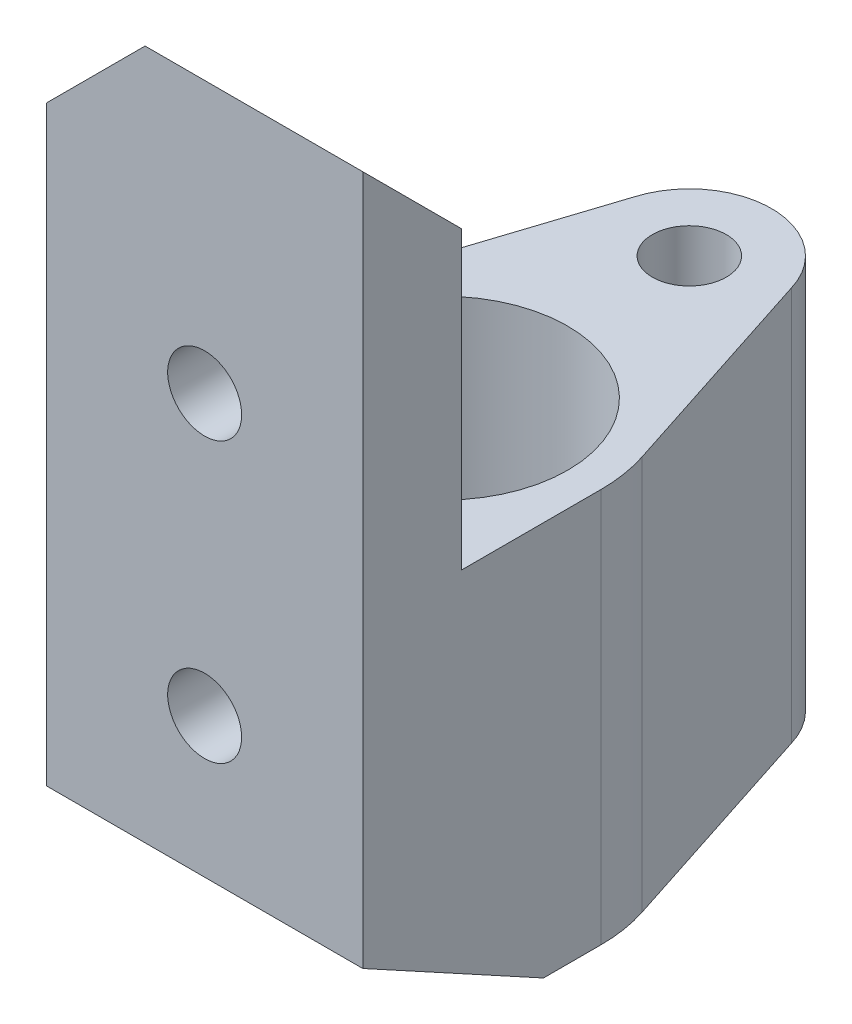
from build123d import *

# Parameters (mm, degrees)
SKETCH1_R           = 7.6
SKETCH1_R_2         = 2.25
BOSS_EXTRUDE1_DEPTH = 24
BOSS_EXTRUDE2_DEPTH = 19.25
CUT_EXTRUDE1_DEPTH  = 56.448737587
CHAMFER1_SIZE       = 6
SKETCH6_R           = 2.25
CUT_EXTRUDE3_DEPTH  = 16
CHAMFER2_SIZE       = 6


with BuildPart() as part:
    # Sketch1 → Boss-Extrude1 (new body)
    with BuildSketch(Plane(origin=(0, 0, 0), x_dir=(1, 0, 0), z_dir=(0, 1, 0))):
        with BuildLine():
            Line((-9.625, -8.5), (9.625, -8.5))
            Line((9.625, -8.5), (9.625, 0))
            ThreePointArc((9.625, 0), (9.506941676, 1.502892202), (9.155662863, 2.968916054))
            Line((9.155662863, 2.968916054), (4.796712187, 16.411223653))
            ThreePointArc((4.796712187, 16.411223653), (0, 20), (-4.796712187, 16.411223653))
            Line((-4.796712187, 16.411223653), (-9.155662863, 2.968916054))
            ThreePointArc((-9.155662863, 2.968916054), (-9.506941676, 1.502892202), (-9.625, 0))
            Line((-9.625, 0), (-9.625, -8.5))
        make_face()
        with Locations(Location((0, 0, 0), (0, 0, 270))):
            Circle(SKETCH1_R, mode=Mode.SUBTRACT)
        with Locations(Location((0, 15, 0), (0, 0, 270))):
            Circle(SKETCH1_R_2, mode=Mode.SUBTRACT)
    extrude(amount=BOSS_EXTRUDE1_DEPTH)

    # Sketch3 → Boss-Extrude2 (add)
    with BuildSketch(Plane.ZY.offset(9.625)):
        Polygon((8.5, 0), (14.5, 0), (14.5, 48), (8.5, 48), (8.5, 24), align=None)
    extrude(amount=-BOSS_EXTRUDE2_DEPTH)

    # Sketch4 → Cut-Extrude1 (cut, through all)
    with BuildSketch(Plane(origin=(9.625, 0, 0), x_dir=(0, 0, -1), z_dir=(1, 0, 0))):
        Polygon((-14.5, 0), (-14.5, 6), (-3.5, 0), align=None)
    extrude(amount=-CUT_EXTRUDE1_DEPTH, mode=Mode.SUBTRACT)

    # Chamfer1
    chamfer1_edges = [part.edges().sort_by_distance(p)[0] for p in [
        (-9.625, 48, 11.5),
    ]]
    chamfer(chamfer1_edges, length=CHAMFER1_SIZE)

    # Sketch6 → Cut-Extrude3 (cut)
    with BuildSketch(Plane.XY.offset(14.5)):
        with Locations((0, 14.504303095)):
            Circle(SKETCH6_R)
        with Locations((0, 31.5)):
            Circle(SKETCH6_R)
    extrude(amount=-CUT_EXTRUDE3_DEPTH, mode=Mode.SUBTRACT)

    # Chamfer2
    chamfer2_edges = [part.edges().sort_by_distance(p)[0] for p in [
        (3, 48, 8.5),
    ]]
    chamfer(chamfer2_edges, length=CHAMFER2_SIZE - 0.0001)  # a hair under: the kernel refuses the full size


solid = part.part
